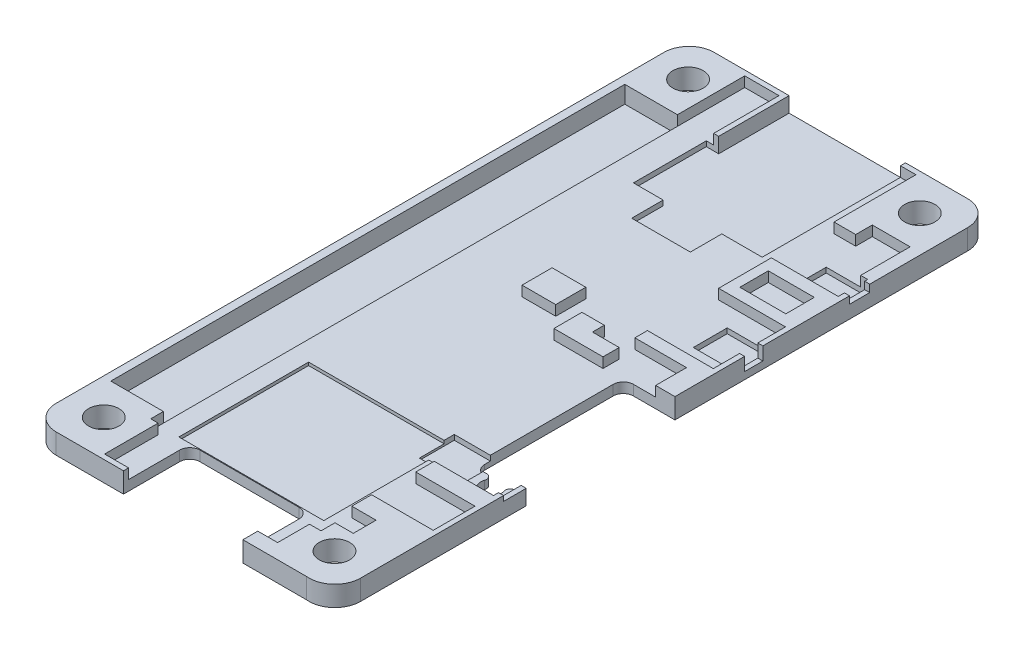
from build123d import *
from build123d.topology import SkipClean

# Parameters (mm, degrees)
BOSS_EXTRUDE1_DEPTH      = 2
SHELL1_T                 = -0.5
BOSS_EXTRUDE3_START      = 1.5
BOSS_EXTRUDE3_DEPTH      = 1.5
SKETCH7_R                = 1.5
CUT_EXTRUDE4_DEPTH       = 36.864526101
CUT_EXTRUDE5_DEPTH       = 36.864526101
CUT_EXTRUDE6_REACH       = 68.754
SKETCH9_W                = 11.5
SKETCH9_H                = 1.5
SKETCH10_W               = 0.73665
SKETCH10_H               = 5.291922
SKETCH10_W_2             = 6.6138774
SKETCH10_H_2             = 5.2104
SKETCH10_W_3             = 4.547646
SKETCH10_H_3             = 2.8161
SKETCH10_W_4             = 5.857488
SKETCH10_H_4             = 1.826866
SKETCH10_W_5             = 0.5
SKETCH10_H_5             = 6.4607
SKETCH10_W_6             = 3.3297711
SKETCH10_H_6             = 2.9719988
BOSS_EXTRUDE4_DEPTH      = 2
SKETCH12_W               = 4.547646
SKETCH12_H               = 2.8161
BOSS_EXTRUDE6_DEPTH      = 0.5
CUT_EXTRUDE7_DEPTH       = 0.5
CUT_EXTRUDE7_DEPTH_BACK  = 36.828818463
SKETCH13_W               = 14.320116
SKETCH13_H               = 12.819992
CUT_EXTRUDE8_START       = -0.5
CUT_EXTRUDE8_OUTLINE_W   = 1.8
CUT_EXTRUDE8_OUTLINE_H   = 1.3
CUT_EXTRUDE8_OUTLINE_W_2 = 2
CUT_EXTRUDE8_OUTLINE_H_2 = 0.722717803
CUT_EXTRUDE8_DEPTH       = 0.5
CUT_EXTRUDE9_DEPTH       = 36.84012043
CUT_EXTRUDE9_DEPTH_BACK  = 0.2
SKETCH15_W               = 5.2
SKETCH15_H               = 50.8
SKETCH16_W               = 4.000248
SKETCH16_H               = 3.499868
CUT_EXTRUDE10_DEPTH      = 0.2
CUT_EXTRUDE11_START      = -0.5
CUT_EXTRUDE11_OUTLINE_W  = 2.232012
CUT_EXTRUDE11_OUTLINE_H  = 0.5
CUT_EXTRUDE11_DEPTH      = 0.5


# Read off the part's stored shape, not the designer's step: Cut-Extrude8, Cut-Extrude11
with BuildPart() as part:
    # Sketch1 → Boss-Extrude1 (new body)
    with BuildSketch(Plane.XZ):
        with BuildLine():
            Line((-15.002764, 30.043374), (-15.002764, -30.021276))
            ThreePointArc((-15.002764, -30.021276), (-14.276432231, -31.77467184), (-12.522962, -32.500824))
            Line((-12.522962, -32.500824), (12.53744, -32.500824))
            ThreePointArc((12.53744, -32.500824), (14.280687318, -31.778747318), (15.002764, -30.0355))
            Line((15.002764, -30.0355), (15.002764, 29.973524))
            ThreePointArc((15.002764, 29.973524), (14.163585126, 31.860357898), (12.200382, 32.500824))
            Line((12.200382, 32.500824), (-12.54506, 32.500824))
            ThreePointArc((-12.54506, 32.500824), (-14.282828873, 31.781068474), (-15.002764, 30.043374))
        make_face()
    extrude(amount=BOSS_EXTRUDE1_DEPTH)

    # Shell1
    shell1_openings = [part.faces().sort_by_distance(p)[0] for p in [
        (-0.00028204, 0, -0.000340146),
    ]]
    offset(amount=SHELL1_T, openings=shell1_openings, kind=Kind.INTERSECTION)

    # Sketch6 → Boss-Extrude3 (add)
    with BuildSketch(Plane(origin=(0, -1.5, 0), x_dir=(1, 0, 0), z_dir=(0, 1, 0)).offset(BOSS_EXTRUDE3_START)):
        with BuildLine():
            Line((-9.002764, 32.500824), (-9.002764, 26.500824))
            Line((-9.002764, 26.500824), (-15.002764, 26.500824))
            Line((-15.002764, 26.500824), (-15.002764, 30.021276))
            ThreePointArc((-15.002764, 30.021276), (-14.276432231, 31.77467184), (-12.522962, 32.500824))
            Line((-12.522962, 32.500824), (-9.002764, 32.500824))
        make_face()
        with BuildLine():
            Line((9.002764, 32.500824), (9.002764, 26.500824))
            Line((9.002764, 26.500824), (15.002764, 26.500824))
            Line((15.002764, 26.500824), (15.002764, 30.0355))
            ThreePointArc((15.002764, 30.0355), (14.280687318, 31.778747318), (12.53744, 32.500824))
            Line((12.53744, 32.500824), (9.002764, 32.500824))
        make_face()
        with BuildLine():
            Line((15.002764, -26.500824), (9.002764, -26.500824))
            Line((9.002764, -26.500824), (9.002764, -32.500824))
            Line((9.002764, -32.500824), (12.200382, -32.500824))
            ThreePointArc((12.200382, -32.500824), (14.163585126, -31.860357898), (15.002764, -29.973524))
            Line((15.002764, -29.973524), (15.002764, -26.500824))
        make_face()
        with BuildLine():
            Line((-12.54506, -32.500824), (-9.002764, -32.500824))
            Line((-9.002764, -32.500824), (-9.002764, -26.500824))
            Line((-9.002764, -26.500824), (-15.002764, -26.500824))
            Line((-15.002764, -26.500824), (-15.002764, -30.043374))
            ThreePointArc((-15.002764, -30.043374), (-14.282828873, -31.781068474), (-12.54506, -32.500824))
        make_face()
    extrude(amount=-BOSS_EXTRUDE3_DEPTH)

    # Sketch7 → Cut-Extrude4 (cut, through all)
    with BuildSketch(Plane.XZ.offset(2)):
        with Locations(Location((-11.447272, 28.901136, 0), (0, 0, 270))):
            Circle(SKETCH7_R)
        with Locations(Location((11.402822, 28.951174, 0), (0, 0, 270))):
            Circle(SKETCH7_R)
        with Locations(Location((11.402822, -28.89885, 0), (0, 0, 270))):
            Circle(SKETCH7_R)
        with Locations(Location((-11.49731, -28.89885, 0), (0, 0, 270))):
            Circle(SKETCH7_R)
    extrude(amount=-CUT_EXTRUDE4_DEPTH, mode=Mode.SUBTRACT)

    # Sketch8 → Cut-Extrude5 (cut, through all)
    with BuildSketch(Plane.XZ.offset(2)):
        with BuildLine():
            Line((-5.897236, 32.500824), (5.902764, 32.500824))
            Line((5.902764, 32.500824), (5.902764, 26.950824))
            ThreePointArc((5.902764, 26.950824), (5.609870781, 26.243717219), (4.902764, 25.950824))
            Line((4.902764, 25.950824), (-4.897236, 25.950824))
            ThreePointArc((-4.897236, 25.950824), (-5.604342781, 26.243717219), (-5.897236, 26.950824))
            Line((-5.897236, 26.950824), (-5.897236, 32.500824))
        make_face()
        with BuildLine():
            Line((15.002764, 13.600824), (15.002764, -1.099176))
            Line((15.002764, -1.099176), (10.901247394, -1.099176))
            ThreePointArc((10.901247394, -1.099176), (10.194140612, -0.806282781), (9.901247394, -0.099176))
            Line((9.901247394, -0.099176), (9.901247394, 12.600824))
            ThreePointArc((9.901247394, 12.600824), (10.194140612, 13.307930781), (10.901247394, 13.600824))
            Line((10.901247394, 13.600824), (11.078663245, 13.600824))
            ThreePointArc((11.078663245, 13.600824), (11.485078263, 13.809573535), (11.552137497, 14.261516667))
            ThreePointArc((11.552137497, 14.261516667), (12.499086, 15.582902), (13.446034503, 14.261516667))
            ThreePointArc((13.446034503, 14.261516667), (13.513093737, 13.809573535), (13.919508755, 13.600824))
            Line((13.919508755, 13.600824), (15.002764, 13.600824))
        make_face()
    extrude(amount=-CUT_EXTRUDE5_DEPTH, mode=Mode.SUBTRACT)

    # Sketch9 → Cut-Extrude6 (cut, up to next)
    with BuildSketch(Plane(origin=(0, 0, -32.500824), x_dir=(-1, 0, 0), z_dir=(0, 0, -1)), mode=Mode.PRIVATE) as cut_extrude6_sk1:
        with Locations((-0.634594, -0.75)):
            Rectangle(SKETCH9_W, SKETCH9_H)
    cut_extrude6_tool1 = extrude(cut_extrude6_sk1.sketch, amount=-CUT_EXTRUDE6_REACH, mode=Mode.PRIVATE) & part.part
    add(cut_extrude6_tool1.solids().sort_by_distance((0.634594, -0.75, -32.500824))[0], mode=Mode.SUBTRACT)

    # Sketch10 → Boss-Extrude4 (add)
    # profile 1 of 11: a face of its own
    with BuildSketch(Plane.XZ.offset(2)):
        Polygon((-14.202764, -25.3492), (-14.202764, 25.4508), (-11.922316, 25.4508), (-11.422316, 25.4508), (-9.002764, 25.4508), (-9.002764, 26.500824), (-15.002764, 26.500824), (-15.002764, -26.500824), (-9.002764, -26.500824), (-9.002764, -25.3492), (-11.422316, -25.3492), (-11.922316, -25.3492), align=None)
    # profile 2 of 11: a face of its own
    with BuildSketch(Plane.XZ.offset(2)):
        Polygon((7.991286, -5.393498), (7.991286, -4.150298), (13.092686, -4.150298), (13.092686, -1.099176), (14.502764, -1.099176), (14.502764, -5.393498), align=None)
    # profile 3 of 11: a face of its own
    with BuildSketch(Plane.XZ.offset(2)):
        Polygon((14.502764, 26.500824), (10.8122863, 26.500824), (10.8122863, 24.2477014), (8.410686, 24.2477014), (8.410686, 22.2917026), (14.502764, 22.2917026), align=None)
    # profile 4 of 11: a face of its own
    with BuildSketch(Plane.XZ.offset(2)):
        Polygon((9.002764, 32.000824), (9.002764, 27.879702), (7.865886, 27.879702), (7.865886, 31.029302), (5.902764, 31.029302), (5.902764, 32.000824), align=None)
    # profile 5 of 11: a face of its own
    with BuildSketch(Plane.XZ.offset(2)):
        with Locations((-8.634439, 29.354863)):
            Rectangle(SKETCH10_W, SKETCH10_H)
    # profile 6 of 11: a face of its own
    with BuildSketch(Plane.XZ.offset(2)):
        with Locations((11.1958253, -15.135098)):
            Rectangle(SKETCH10_W_2, SKETCH10_H_2)
        with Locations((11.123663, -15.071852)):
            Rectangle(SKETCH10_W_3, SKETCH10_H_3, mode=Mode.SUBTRACT)
    # profile 7 of 11: a face of its own
    with BuildSketch(Plane.XZ.offset(2)):
        with Locations((11.57402, 17.246269)):
            Rectangle(SKETCH10_W_4, SKETCH10_H_4)
    # profile 8 of 11: a face of its own
    with BuildSketch(Plane.XZ.offset(2)):
        with Locations((-5.365406, -28.770474)):
            Rectangle(SKETCH10_W_5, SKETCH10_H_5)
    # profile 9 of 11: a face of its own
    with BuildSketch(Plane.XZ.offset(2)):
        Polygon((9.002764, -32.000824), (7.921932, -32.000824), (7.921932, -23.902698), (10.06259, -23.902698), (10.06259, -25.540744), (13.803886, -25.540744), (13.803886, -20.651498), (14.502764, -20.651498), (14.502764, -26.500824), (9.002764, -26.500824), align=None)
    # profile 10 of 11: a face of its own
    with BuildSketch(Plane.XZ.offset(2)):
        Polygon((3.192286, -3.719498), (5.399886, -3.719498), (5.399886, -2.547098), (8.043086, -2.547098), (8.043086, -0.9490986), (3.192286, -0.9490986), align=None)
    # profile 11 of 11: a face of its own
    with BuildSketch(Plane.XZ.offset(2)):
        with Locations((-0.43060015, -4.568698)):
            Rectangle(SKETCH10_W_6, SKETCH10_H_6)
    extrude(amount=-BOSS_EXTRUDE4_DEPTH)

    # Sketch12 → Boss-Extrude6 (add)
    with SkipClean():  # the faces are left unmerged after this step: merging them gives an invalid solid
        with BuildSketch(Plane(origin=(0, -1.5, 0), x_dir=(1, 0, 0), z_dir=(0, 1, 0))):
            with BuildLine():
                Line((14.502764, 7.209380255), (10.705486, 7.209380255))
                Line((10.705486, 7.209380255), (10.705486, 10.564015745))
                Line((10.705486, 10.564015745), (14.502764, 10.564015745))
                Line((14.502764, 10.564015745), (14.502764, 12.529898))
                Line((14.502764, 12.529898), (7.8888866, 12.529898))
                Line((7.8888866, 12.529898), (7.8888866, 17.740298))
                Line((7.8888866, 17.740298), (10.400724, 17.740298))
                Line((10.400724, 17.740298), (10.400724, 20.651498))
                Line((10.400724, 20.651498), (13.803886, 20.651498))
                Line((13.803886, 20.651498), (13.803886, 25.540744))
                Line((13.803886, 25.540744), (10.06259, 25.540744))
                Line((10.06259, 25.540744), (10.06259, 23.902698))
                Line((10.06259, 23.902698), (7.921932, 23.902698))
                Line((7.921932, 23.902698), (7.921932, 32.000824))
                Line((7.921932, 32.000824), (6.384594, 32.000824))
                Line((6.384594, 32.000824), (6.384594, 18.340124))
                Line((6.384594, 18.340124), (2.393486, 18.340124))
                Line((2.393486, 18.340124), (2.393486, 15.229798))
                Line((2.393486, 15.229798), (-3.404914, 15.229798))
                Line((-3.404914, 15.229798), (-3.404914, 18.340124))
                Line((-3.404914, 18.340124), (-6.340406, 18.340124))
                Line((-6.340406, 18.340124), (-6.340406, 25.540124))
                Line((-6.340406, 25.540124), (-5.615406, 25.540124))
                Line((-5.615406, 25.540124), (-5.615406, 32.000824))
                Line((-5.615406, 32.000824), (-9.002764, 32.000824))
                Line((-9.002764, 32.000824), (-9.002764, -26.708902))
                Line((-9.002764, -26.708902), (-8.266114, -26.708902))
                Line((-8.266114, -26.708902), (-8.266114, -32.000824))
                Line((-8.266114, -32.000824), (-5.897236, -32.000824))
                Line((-5.897236, -32.000824), (-5.897236, -26.950824))
                ThreePointArc((-5.897236, -26.950824), (-5.604342781, -26.243717219), (-4.897236, -25.950824))
                Line((-4.897236, -25.950824), (4.902764, -25.950824))
                ThreePointArc((4.902764, -25.950824), (5.609870781, -26.243717219), (5.902764, -26.950824))
                Line((5.902764, -26.950824), (5.902764, -31.029302))
                Line((5.902764, -31.029302), (7.865886, -31.029302))
                Line((7.865886, -31.029302), (7.865886, -27.879702))
                Line((7.865886, -27.879702), (9.002764, -27.879702))
                Line((9.002764, -27.879702), (9.002764, -26.500824))
                Line((9.002764, -26.500824), (10.8122863, -26.500824))
                Line((10.8122863, -26.500824), (10.8122863, -24.2477014))
                Line((10.8122863, -24.2477014), (8.410686, -24.2477014))
                Line((8.410686, -24.2477014), (8.410686, -22.2917026))
                Line((8.410686, -22.2917026), (14.502764, -22.2917026))
                Line((14.502764, -22.2917026), (14.502764, -18.159702))
                Line((14.502764, -18.159702), (8.645276, -18.159702))
                Line((8.645276, -18.159702), (8.645276, -16.332836))
                Line((8.645276, -16.332836), (14.502764, -16.332836))
                Line((14.502764, -16.332836), (14.502764, -13.600824))
                Line((14.502764, -13.600824), (13.919508755, -13.600824))
                ThreePointArc((13.919508755, -13.600824), (13.513093737, -13.809573535), (13.446034503, -14.261516667))
                ThreePointArc((13.446034503, -14.261516667), (12.499086, -15.582902), (11.552137497, -14.261516667))
                ThreePointArc((11.552137497, -14.261516667), (11.485078263, -13.809573535), (11.078663245, -13.600824))
                Line((11.078663245, -13.600824), (10.901247394, -13.600824))
                ThreePointArc((10.901247394, -13.600824), (10.818684818, -13.597409882), (10.736686, -13.587190842))
                Line((10.736686, -13.587190842), (10.736686, -15.497047053))
                Line((10.736686, -15.497047053), (6.336686, -15.497047053))
                Line((6.336686, -15.497047053), (6.336686, -12.043156947))
                Line((6.336686, -12.043156947), (9.901247394, -12.043156947))
                Line((9.901247394, -12.043156947), (9.901247394, 0.099176))
                ThreePointArc((9.901247394, 0.099176), (10.194140612, 0.806282781), (10.901247394, 1.099176))
                Line((10.901247394, 1.099176), (13.092686, 1.099176))
                Line((13.092686, 1.099176), (13.092686, 4.150298))
                Line((13.092686, 4.150298), (7.991286, 4.150298))
                Line((7.991286, 4.150298), (7.991286, 5.393498))
                Line((7.991286, 5.393498), (14.502764, 5.393498))
                Line((14.502764, 5.393498), (14.502764, 7.209380255))
            make_face()
            with Locations((11.123663, 15.071852)):
                Rectangle(SKETCH12_W, SKETCH12_H)
        extrude(amount=BOSS_EXTRUDE6_DEPTH)

    # Sketch13 → Cut-Extrude7 (cut, two sides: drawn at the far end of the back side and taken through both)
    with SkipClean():  # the faces are left unmerged after this step: merging them gives an invalid solid
        with BuildSketch(Plane.XZ.offset(0.8).offset(-CUT_EXTRUDE7_DEPTH_BACK)):
            with Locations((0.103886, 19.459702)):
                Rectangle(SKETCH13_W, SKETCH13_H)
        extrude(amount=CUT_EXTRUDE7_DEPTH + CUT_EXTRUDE7_DEPTH_BACK, mode=Mode.SUBTRACT)

    # Cut-Extrude8 outline → Cut-Extrude8 (cut)
    with SkipClean():  # the faces are left unmerged after this step: merging them gives an invalid solid
        with BuildSketch(Plane(origin=(15.002764, 0, 0), x_dir=(0, 0, -1), z_dir=(1, 0, 0)).offset(CUT_EXTRUDE8_START)):
            with Locations((8.886698, -0.65)):
                Rectangle(CUT_EXTRUDE8_OUTLINE_W, CUT_EXTRUDE8_OUTLINE_H)
            with Locations((19.351498, -0.361358901)):
                Rectangle(CUT_EXTRUDE8_OUTLINE_W_2, CUT_EXTRUDE8_OUTLINE_H_2)
        extrude(amount=CUT_EXTRUDE8_DEPTH, mode=Mode.SUBTRACT)

    # Sketch15 → Cut-Extrude9 (cut, two sides: drawn at the far end of the back side and taken through both)
    with SkipClean():  # the faces are left unmerged after this step: merging them gives an invalid solid
        with BuildSketch(Plane(origin=(0, -1.5, 0), x_dir=(1, 0, 0), z_dir=(0, 1, 0)).offset(-CUT_EXTRUDE9_DEPTH_BACK)):
            with Locations((-11.602764, -0.0508)):
                Rectangle(SKETCH15_W, SKETCH15_H)
        extrude(amount=CUT_EXTRUDE9_DEPTH + CUT_EXTRUDE9_DEPTH_BACK, mode=Mode.SUBTRACT)

    # Sketch16 → Cut-Extrude10 (cut)
    with SkipClean():  # the faces are left unmerged after this step: merging them gives an invalid solid
        with BuildSketch(Plane(origin=(0, -1, 0), x_dir=(1, 0, 0), z_dir=(0, 1, 0))):
            with Locations((12.499086, -14.582902)):
                Rectangle(SKETCH16_W, SKETCH16_H)
        extrude(amount=-CUT_EXTRUDE10_DEPTH, mode=Mode.SUBTRACT)

    # Cut-Extrude11 outline → Cut-Extrude11 (cut)
    with SkipClean():  # the faces are left unmerged after this step: merging them gives an invalid solid
        with BuildSketch(Plane(origin=(15.002764, 0, 0), x_dir=(0, 0, -1), z_dir=(1, 0, 0)).offset(CUT_EXTRUDE11_START)):
            with Locations((-14.71683, -0.25)):
                Rectangle(CUT_EXTRUDE11_OUTLINE_W, CUT_EXTRUDE11_OUTLINE_H)
        extrude(amount=CUT_EXTRUDE11_DEPTH, mode=Mode.SUBTRACT)


solid = part.part
